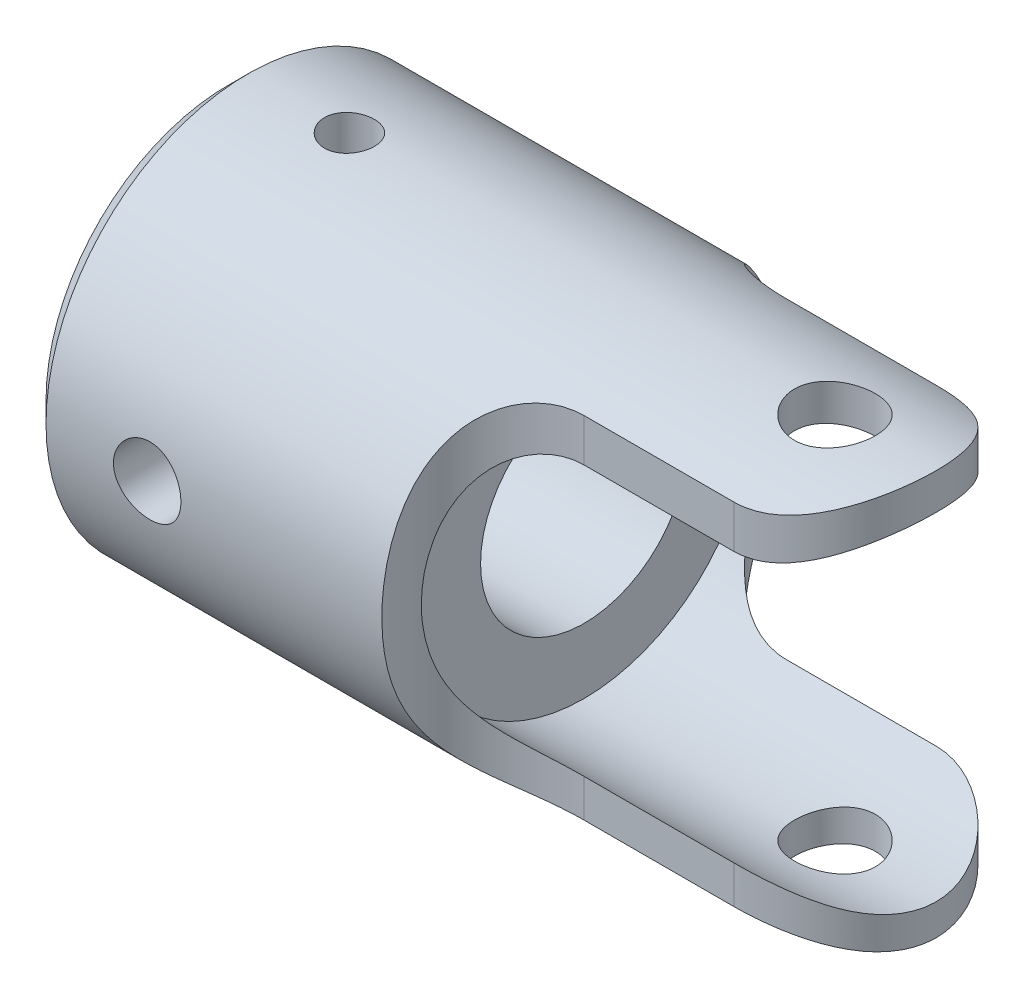
from build123d import *

# Parameters (mm, degrees)
SKETCH2_W               = 0.7835
SKETCH2_H               = 3.359275505
CUT_EXTRUDE1_DEPTH      = 6.684210526
CUT_EXTRUDE1_DEPTH_BACK = 6.684210526
CUT_EXTRUDE2_DEPTH      = 6.684210526
CUT_EXTRUDE2_DEPTH_BACK = 6.684210526
SKETCH6_R               = 1.27


with BuildPart() as part:
    # Sketch1 → Revolve1 (revolve)
    with BuildSketch(Plane.XY):
        Polygon((-19.05, 0), (-19.05, 5.715508), (-18.415508, 6.35), (12.7, 6.35), (12.7, 0), align=None)
    revolve(axis=Axis((12.7, 0, 0), (-1, 0, 0)))

    # Sketch2 → Cut-Revolve1 (revolve, cut)
    with BuildSketch(Plane.XY):
        with Locations((-14.84825, 4.670362247)):
            Rectangle(SKETCH2_W, SKETCH2_H)
    revolve(axis=Axis((-15.24, 2.990724495, 0), (0, 1, 0)), mode=Mode.SUBTRACT)

    # Sketch3 → Cut-Revolve2 (revolve, cut)
    with BuildSketch(Plane(origin=(0, 0, 0), x_dir=(1, 0, 0), z_dir=(0, 1, 0))):
        Polygon((-15.24, -4.150200965), (-14.181666667, -4.76123), (-14.181666667, -11.10615), (-15.24, -11.10615), align=None)
    revolve(axis=Axis((-15.24, 0, 11.10615), (0, 0, -1)), mode=Mode.SUBTRACT)

    # Sketch4 → Cut-Extrude1 (cut, two sides: drawn at the far end of the back side and taken through both)
    with BuildSketch(Plane(origin=(0, 0, 0), x_dir=(1, 0, 0), z_dir=(0, 1, 0)).offset(-CUT_EXTRUDE1_DEPTH_BACK)):
        with BuildLine():
            Line((-7.874, -15.875), (25.4, -15.875))
            Line((25.4, -15.875), (25.4, 15.875))
            Line((25.4, 15.875), (-7.874, 15.875))
            Line((-7.874, 15.875), (-7.874, 6.35))
            ThreePointArc((-7.874, 6.35), (-6.94406403, 4.10493597), (-4.699, 3.175))
            Line((-4.699, 3.175), (0, 3.175))
            ThreePointArc((0, 3.175), (3.175, 0), (0, -3.175))
            Line((0, -3.175), (-4.699, -3.175))
            ThreePointArc((-4.699, -3.175), (-6.94406403, -4.10493597), (-7.874, -6.35))
            Line((-7.874, -6.35), (-7.874, -15.875))
        make_face()
    extrude(amount=CUT_EXTRUDE1_DEPTH + CUT_EXTRUDE1_DEPTH_BACK, mode=Mode.SUBTRACT)

    # Sketch5 → Cut-Revolve3 (revolve, cut)
    with BuildSketch(Plane.XY):
        Polygon((-19.0754, -0.07754), (-19.0754, 3.17246), (-7.874, 3.17246), (-7.874, 5.214126667), (12.6746, 5.214126667), (12.6746, -0.07754), align=None)
    revolve(axis=Axis((12.6746, -0.07754, 0), (-1, 0, 0)), mode=Mode.SUBTRACT)

    # Sketch6 → Cut-Extrude2 (cut, two sides: drawn at the far end of the back side and taken through both)
    with BuildSketch(Plane(origin=(0, 0, 0), x_dir=(1, 0, 0), z_dir=(0, 1, 0)).offset(-CUT_EXTRUDE2_DEPTH_BACK)):
        Circle(SKETCH6_R)
    extrude(amount=CUT_EXTRUDE2_DEPTH + CUT_EXTRUDE2_DEPTH_BACK, mode=Mode.SUBTRACT)


solid = part.part
